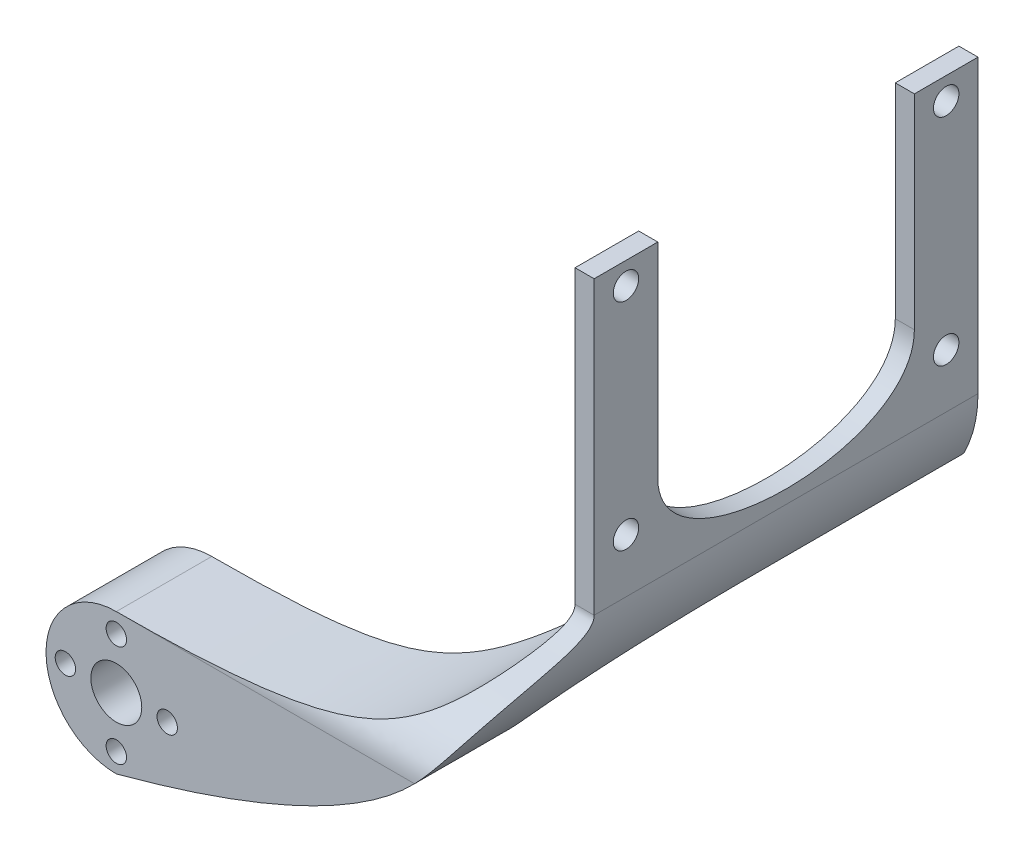
from build123d import *

# Parameters (mm, degrees)
BOSS_EXTRUDE1_START     = -60.5
BOSS_EXTRUDE1_OUTLINE_R = 2
BOSS_EXTRUDE1_DEPTH     = 121
SKETCH1_W               = 179.187175662
SKETCH1_H               = 206.234296517
SKETCH1_R               = 1.6025
SKETCH1_R_2             = 4
CUT_EXTRUDE1_DEPTH      = 80


# Read off the part's stored shape, not the designer's step: Boss-Extrude1
with BuildPart() as part:
    # Boss-Extrude1 outline → Boss-Extrude1 (new body)
    with BuildSketch(Plane(origin=(0, 0, 0), x_dir=(0, 0, -1), z_dir=(1, 0, 0)).offset(BOSS_EXTRUDE1_START)):
        with BuildLine():
            Line((6.0465, 72.85), (6.0465, 27.05))
            add(Edge.make_bspline(
                [(6.0465, 27.05), (6.0465, 21.716666667), (-15, 21.716666667), (-15, 11.05)],
                knots=[0, 0, 0, 0, 1, 1, 1, 1], degree=3))
            Line((-15, 11.05), (-15, -11.05))
            Line((-15, -11.05), (0, -11.05))
            Line((0, -11.05), (0, 11.05))
            add(Edge.make_bspline(
                [(0, 11.05), (0, 17.784890874), (36.209, 17.784890874)],
                knots=[0, 0, 0, 1, 1, 1], degree=2))
            Line((36.209, 17.784890874), (66.3715, 17.784890874))
            Line((66.3715, 17.784890874), (66.3715, 72.85))
            Line((66.3715, 72.85), (56.3715, 72.85))
            Line((56.3715, 72.85), (56.3715, 40.748146134))
            add(Edge.make_bspline(
                [(56.3715, 40.748146134), (56.3715, 25.284890874), (16.0465, 25.284890874), (16.0465, 40.748146134)],
                knots=[0, 0, 0, 0, 1, 1, 1, 1], degree=3))
            Line((16.0465, 40.748146134), (16.0465, 72.85))
            Line((16.0465, 72.85), (6.0465, 72.85))
        make_face()
        with Locations((11.0465, 35.516666667)):
            Circle(BOSS_EXTRUDE1_OUTLINE_R, mode=Mode.SUBTRACT)
        with Locations((11.0465, 69.383333333)):
            Circle(BOSS_EXTRUDE1_OUTLINE_R, mode=Mode.SUBTRACT)
        with Locations((61.3715, 35.516666667)):
            Circle(BOSS_EXTRUDE1_OUTLINE_R, mode=Mode.SUBTRACT)
        with Locations((61.3715, 69.383333333)):
            Circle(BOSS_EXTRUDE1_OUTLINE_R, mode=Mode.SUBTRACT)
    extrude(amount=BOSS_EXTRUDE1_DEPTH)

    # Sketch1 → Cut-Extrude1 (cut, symmetric)
    # profile 1 of 6: a face of its own
    with BuildSketch(Plane.XY):
        with Locations((-22.097828966, 29.224383364)):
            Rectangle(SKETCH1_W, SKETCH1_H)
        with BuildLine():
            add(Edge.make_bspline(
                [(0, -11.05), (54.05, 3.432653851), (54.05, 27.05)],
                knots=[0, 0, 0, 1, 1, 1], degree=2))
            Line((54.05, 27.05), (54.05, 72.85))
            Line((54.05, 72.85), (51.05, 72.85))
            Line((51.05, 72.85), (51.05, 27.05))
            add(Edge.make_bspline(
                [(0, 11.05), (51.05, 11.05), (51.05, 27.05)],
                knots=[0, 0, 0, 1, 1, 1], degree=2))
            ThreePointArc((0, 11.05), (-11.05, 0), (0, -11.05))
        make_face(mode=Mode.SUBTRACT)
    # profile 2 of 6: a face of its own
    with BuildSketch(Plane.XY):
        with Locations((8, 0)):
            Circle(SKETCH1_R)
    # profile 3 of 6: a face of its own
    with BuildSketch(Plane.XY):
        with Locations((0, 8)):
            Circle(SKETCH1_R)
    # profile 4 of 6: a face of its own
    with BuildSketch(Plane.XY):
        with Locations((-8, 0)):
            Circle(SKETCH1_R)
    # profile 5 of 6: a face of its own
    with BuildSketch(Plane.XY):
        with Locations((0, -8)):
            Circle(SKETCH1_R)
    # profile 6 of 6: a face of its own
    with BuildSketch(Plane.XY):
        Circle(SKETCH1_R_2)
    extrude(amount=CUT_EXTRUDE1_DEPTH, both=True, mode=Mode.SUBTRACT)


solid = part.part
